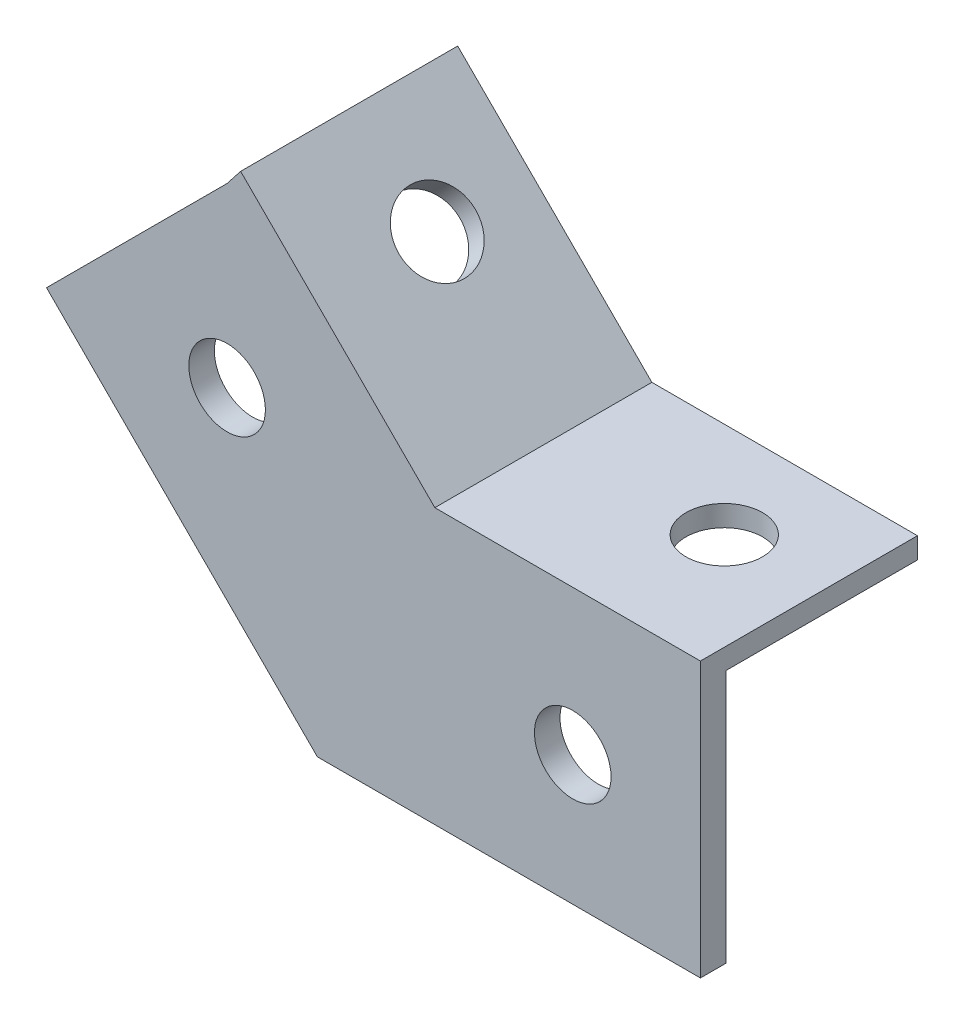
from build123d import *

# Parameters (mm, degrees)
ESBO_O1_R                = 3
RESSALTO_EXTRUS_O1_DEPTH = 2
RESSALTO_EXTRUS_O2_DEPTH = 17
CORTE_EXTRUS_O1_REACH    = 96.288
ESBO_O6_R                = 3
CORTE_EXTRUS_O2_REACH    = 98.831
ESBO_O7_R                = 3


with BuildPart() as part:
    # Esboço1 → Ressalto-extrusão1 (new body)
    with BuildSketch(Plane.XY):
        Polygon((-42.366282029, -154.146561088), (-42.366282029, -174), (-72.366282029, -174), (-93.579485465, -152.786796564), (-79.437349841, -138.644660941), (-63.935449693, -154.146561088), align=None)
        with Locations((-79.437349841, -152.493674388)):
            Circle(ESBO_O1_R, mode=Mode.SUBTRACT)
        with Locations((-52.36628203, -163.853438912)):
            Circle(ESBO_O1_R, mode=Mode.SUBTRACT)
    extrude(amount=RESSALTO_EXTRUS_O1_DEPTH)

    # Esboço5 → Ressalto-extrusão2 (add)
    with BuildSketch(Plane.XY.offset(2)):
        Polygon((-78.376689669, -137.290878593), (-79.437349841, -138.644660941), (-63.935449693, -154.146561088), (-42.366282029, -154.146561088), (-42.366282029, -152.5), (-63.167568262, -152.5), align=None)
    extrude(amount=-RESSALTO_EXTRUS_O2_DEPTH)

    # Esboço6 → Corte-extrusão1 (cut, up to next)
    with BuildSketch(Plane(origin=(-109.041005391, -109.041005391, 0), x_dir=(-0.7071067811865479, 0.7071067811865472, 0), z_dir=(-0.7071067811865472, -0.7071067811865479, 0)), mode=Mode.PRIVATE) as corte_extrus_o1_sk1:
        with Locations((-50, 7.5)):
            Circle(ESBO_O6_R)
    corte_extrus_o1_tool1 = extrude(corte_extrus_o1_sk1.sketch, amount=-CORTE_EXTRUS_O1_REACH, mode=Mode.PRIVATE) & part.part
    add(corte_extrus_o1_tool1.solids().sort_by_distance((-73.685666, -144.396344, -7.5))[0], mode=Mode.SUBTRACT)

    # Esboço7 → Corte-extrusão2 (cut, up to next)
    with BuildSketch(Plane.XZ.offset(154.146561088), mode=Mode.PRIVATE) as corte_extrus_o2_sk1:
        with Locations((-50, -7.5)):
            Circle(ESBO_O7_R)
    corte_extrus_o2_tool1 = extrude(corte_extrus_o2_sk1.sketch, amount=-CORTE_EXTRUS_O2_REACH, mode=Mode.PRIVATE) & part.part
    add(corte_extrus_o2_tool1.solids().sort_by_distance((-50, -154.146561, -7.5))[0], mode=Mode.SUBTRACT)


solid = part.part
